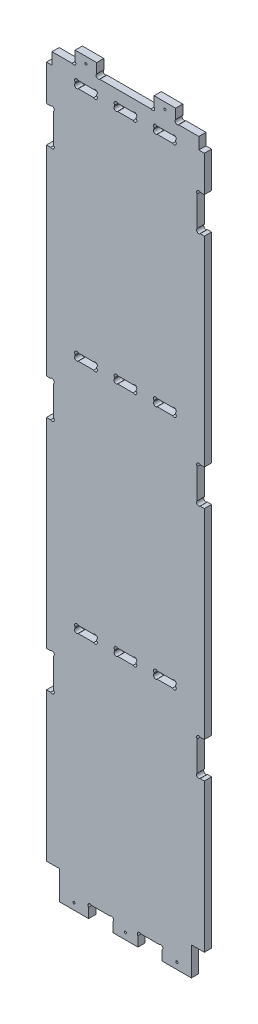
from build123d import *

# Parameters (mm, degrees)
BOSS_EXTRUDE1_DEPTH   = 10
SKETCH3_W             = 18
SKETCH3_H             = 40.02
CUT_EXTRUDE2_DEPTH    = 51
CAVITY2_START         = -19
CAVITY2_OUTLINE_W     = 80
CAVITY2_OUTLINE_H     = 10
CAVITY2_OUTLINE_R     = 1.5
CAVITY2_OUTLINE_W_2   = 32.3
CAVITY2_DEPTH         = 18
CAVITY2_START_2       = -1039.94
CAVITY2_2_OUTLINE_W   = 33.8
CAVITY2_2_OUTLINE_H   = 10
CAVITY2_2_OUTLINE_R   = 1.5
CAVITY2_2_DEPTH       = 18
CAVITY2_START_3       = -793.12
CAVITY2_3_OUTLINE_W   = 10
CAVITY2_3_OUTLINE_H   = 10
CAVITY2_3_DEPTH       = 50
CAVITY2_START_4       = -464.3
CAVITY2_4_OUTLINE_W   = 10
CAVITY2_4_OUTLINE_H   = 10
CAVITY2_4_DEPTH       = 50
CAVITY2_START_5       = -135.46
CAVITY2_5_OUTLINE_W   = 10
CAVITY2_5_OUTLINE_H   = 10
CAVITY2_5_DEPTH       = 50
CAVITY2_START_6       = -703.12
CAVITY2_6_DEPTH       = 10
CAVITY2_START_7       = -374.3
CAVITY2_7_DEPTH       = 10
CAVITY2_START_8       = -45.46
CAVITY2_8_DEPTH       = 10
F_3_0MM_DOWEL_HOLE1_D = 3
SKETCH7_R             = 3
CUT_EXTRUDE4_DEPTH    = 10
SKETCH6_W             = 80
SKETCH6_H             = 18
SKETCH6_W_2           = 32.3
CUT_EXTRUDE5_DEPTH    = 10
SKETCH8_W             = 30
SKETCH8_H             = 10
CUT_EXTRUDE6_DEPTH    = 1061.388704015


# Read off the part's stored shape, not the designer's step: Cavity2
with BuildPart() as part:
    # Sketch1 → Boss-Extrude1 (new body)
    with BuildSketch(Plane.XY):
        Polygon((13, -35.36), (5.3, -35.36), (5.3, -1), (-199.3, -1), (-199.3, -35.36), (-207, -35.36), (-207, -1039.94), (13, -1039.94), align=None)
    extrude(amount=-BOSS_EXTRUDE1_DEPTH)

    # Sketch3 → Cut-Extrude2 (cut)
    with BuildSketch(Plane.XY):
        with Locations((-198, -1019.93)):
            Rectangle(SKETCH3_W, SKETCH3_H)
        with Locations((4, -1019.93)):
            Rectangle(SKETCH3_W, SKETCH3_H)
    extrude(amount=-CUT_EXTRUDE2_DEPTH, mode=Mode.SUBTRACT)

    # Cavity2 outline → Cavity2 (cut)
    # profile 1 of 3: a face of its own
    with BuildSketch(Plane(origin=(0, 0, 0), x_dir=(1, 0, 0), z_dir=(0, 1, 0)).offset(CAVITY2_START)):
        with Locations((-97, 5)):
            Rectangle(CAVITY2_OUTLINE_W, CAVITY2_OUTLINE_H)
        with Locations((-97, 5)):
            Circle(CAVITY2_OUTLINE_R, mode=Mode.SUBTRACT)
    # profile 2 of 3: a face of its own
    with BuildSketch(Plane(origin=(0, 0, 0), x_dir=(1, 0, 0), z_dir=(0, 1, 0)).offset(CAVITY2_START)):
        with Locations((-183.15, 5)):
            Rectangle(CAVITY2_OUTLINE_W_2, CAVITY2_OUTLINE_H)
        with Locations((-183.15, 5)):
            Circle(CAVITY2_OUTLINE_R, mode=Mode.SUBTRACT)
    # profile 3 of 3: a face of its own
    with BuildSketch(Plane(origin=(0, 0, 0), x_dir=(1, 0, 0), z_dir=(0, 1, 0)).offset(CAVITY2_START)):
        with Locations((-10.85, 5)):
            Rectangle(CAVITY2_OUTLINE_W_2, CAVITY2_OUTLINE_H)
        with Locations((-10.85, 5)):
            Circle(CAVITY2_OUTLINE_R, mode=Mode.SUBTRACT)
    extrude(amount=CAVITY2_DEPTH, mode=Mode.SUBTRACT)

    # Cavity2 2 outline → Cavity2 2 (cut)
    # profile 1 of 2: a face of its own
    with BuildSketch(Plane(origin=(0, 0, 0), x_dir=(1, 0, 0), z_dir=(0, 1, 0)).offset(CAVITY2_START_2)):
        with Locations((-131.4, 5)):
            Rectangle(CAVITY2_2_OUTLINE_W, CAVITY2_2_OUTLINE_H)
        with Locations((-131.4, 5)):
            Circle(CAVITY2_2_OUTLINE_R, mode=Mode.SUBTRACT)
    # profile 2 of 2: a face of its own
    with BuildSketch(Plane(origin=(0, 0, 0), x_dir=(1, 0, 0), z_dir=(0, 1, 0)).offset(CAVITY2_START_2)):
        with Locations((-62.6, 5)):
            Rectangle(CAVITY2_2_OUTLINE_W, CAVITY2_2_OUTLINE_H)
        with Locations((-62.6, 5)):
            Circle(CAVITY2_2_OUTLINE_R, mode=Mode.SUBTRACT)
    extrude(amount=CAVITY2_2_DEPTH, mode=Mode.SUBTRACT)

    # Cavity2 3 outline → Cavity2 3 (cut)
    with BuildSketch(Plane(origin=(0, 0, 0), x_dir=(1, 0, 0), z_dir=(0, 1, 0)).offset(CAVITY2_START_3)):
        with Locations((-202, 5)):
            Rectangle(CAVITY2_3_OUTLINE_W, CAVITY2_3_OUTLINE_H)
        with Locations((8, 5)):
            Rectangle(CAVITY2_3_OUTLINE_W, CAVITY2_3_OUTLINE_H)
    extrude(amount=CAVITY2_3_DEPTH, mode=Mode.SUBTRACT)

    # Cavity2 4 outline → Cavity2 4 (cut)
    with BuildSketch(Plane(origin=(0, 0, 0), x_dir=(1, 0, 0), z_dir=(0, 1, 0)).offset(CAVITY2_START_4)):
        with Locations((-202, 5)):
            Rectangle(CAVITY2_4_OUTLINE_W, CAVITY2_4_OUTLINE_H)
        with Locations((8, 5)):
            Rectangle(CAVITY2_4_OUTLINE_W, CAVITY2_4_OUTLINE_H)
    extrude(amount=CAVITY2_4_DEPTH, mode=Mode.SUBTRACT)

    # Cavity2 5 outline → Cavity2 5 (cut)
    with BuildSketch(Plane(origin=(0, 0, 0), x_dir=(1, 0, 0), z_dir=(0, 1, 0)).offset(CAVITY2_START_5)):
        with Locations((-202, 5)):
            Rectangle(CAVITY2_5_OUTLINE_W, CAVITY2_5_OUTLINE_H)
        with Locations((8, 5)):
            Rectangle(CAVITY2_5_OUTLINE_W, CAVITY2_5_OUTLINE_H)
    extrude(amount=CAVITY2_5_DEPTH, mode=Mode.SUBTRACT)

    # Cavity2 6 outline → Cavity2 6 (cut)
    with BuildSketch(Plane(origin=(0, 0, 0), x_dir=(1, 0, 0), z_dir=(0, 1, 0)).offset(CAVITY2_START_6)):
        with BuildLine():
            Line((-137, 0), (-137, 5.757359313))
            ThreePointArc((-137, 5.757359313), (-137.878679656, 7.878679657), (-137, 10))
            Line((-137, 10), (-167, 10))
            ThreePointArc((-167, 10), (-166.121320344, 7.878679657), (-167, 5.757359313))
            Line((-167, 5.757359313), (-167, 0))
            Line((-167, 0), (-137, 0))
        make_face()
        with BuildLine():
            Line((-112, 5.757359313), (-112, 0))
            Line((-112, 0), (-82, 0))
            Line((-82, 0), (-82, 5.757359313))
            ThreePointArc((-82, 5.757359313), (-82.878679656, 7.878679657), (-82, 10))
            Line((-82, 10), (-112, 10))
            ThreePointArc((-112, 10), (-111.121320344, 7.878679657), (-112, 5.757359313))
        make_face()
        with BuildLine():
            Line((-57, 5.757359313), (-57, 0))
            Line((-57, 0), (-27, 0))
            Line((-27, 0), (-27, 5.757359313))
            ThreePointArc((-27, 5.757359313), (-27.878679656, 7.878679657), (-27, 10))
            Line((-27, 10), (-57, 10))
            ThreePointArc((-57, 10), (-56.121320344, 7.878679657), (-57, 5.757359313))
        make_face()
    extrude(amount=CAVITY2_6_DEPTH, mode=Mode.SUBTRACT)

    # Cavity2 7 outline → Cavity2 7 (cut)
    with BuildSketch(Plane(origin=(0, 0, 0), x_dir=(1, 0, 0), z_dir=(0, 1, 0)).offset(CAVITY2_START_7)):
        with BuildLine():
            Line((-137, 0), (-137, 5.757359313))
            ThreePointArc((-137, 5.757359313), (-137.878679656, 7.878679657), (-137, 10))
            Line((-137, 10), (-167, 10))
            ThreePointArc((-167, 10), (-166.121320344, 7.878679657), (-167, 5.757359313))
            Line((-167, 5.757359313), (-167, 0))
            Line((-167, 0), (-137, 0))
        make_face()
        with BuildLine():
            Line((-112, 5.757359313), (-112, 0))
            Line((-112, 0), (-82, 0))
            Line((-82, 0), (-82, 5.757359313))
            ThreePointArc((-82, 5.757359313), (-82.878679656, 7.878679657), (-82, 10))
            Line((-82, 10), (-112, 10))
            ThreePointArc((-112, 10), (-111.121320344, 7.878679657), (-112, 5.757359313))
        make_face()
        with BuildLine():
            Line((-57, 5.757359313), (-57, 0))
            Line((-57, 0), (-27, 0))
            Line((-27, 0), (-27, 5.757359313))
            ThreePointArc((-27, 5.757359313), (-27.878679656, 7.878679657), (-27, 10))
            Line((-27, 10), (-57, 10))
            ThreePointArc((-57, 10), (-56.121320344, 7.878679657), (-57, 5.757359313))
        make_face()
    extrude(amount=CAVITY2_7_DEPTH, mode=Mode.SUBTRACT)

    # Cavity2 8 outline → Cavity2 8 (cut)
    with BuildSketch(Plane(origin=(0, 0, 0), x_dir=(1, 0, 0), z_dir=(0, 1, 0)).offset(CAVITY2_START_8)):
        with BuildLine():
            Line((-137, 0), (-137, 5.757359313))
            ThreePointArc((-137, 5.757359313), (-137.878679656, 7.878679657), (-137, 10))
            Line((-137, 10), (-167, 10))
            ThreePointArc((-167, 10), (-166.121320344, 7.878679657), (-167, 5.757359313))
            Line((-167, 5.757359313), (-167, 0))
            Line((-167, 0), (-137, 0))
        make_face()
        with BuildLine():
            Line((-112, 5.757359313), (-112, 0))
            Line((-112, 0), (-82, 0))
            Line((-82, 0), (-82, 5.757359313))
            ThreePointArc((-82, 5.757359313), (-82.878679656, 7.878679657), (-82, 10))
            Line((-82, 10), (-112, 10))
            ThreePointArc((-112, 10), (-111.121320344, 7.878679657), (-112, 5.757359313))
        make_face()
        with BuildLine():
            Line((-57, 5.757359313), (-57, 0))
            Line((-57, 0), (-27, 0))
            Line((-27, 0), (-27, 5.757359313))
            ThreePointArc((-27, 5.757359313), (-27.878679656, 7.878679657), (-27, 10))
            Line((-27, 10), (-57, 10))
            ThreePointArc((-57, 10), (-56.121320344, 7.878679657), (-57, 5.757359313))
        make_face()
    extrude(amount=CAVITY2_8_DEPTH, mode=Mode.SUBTRACT)

    # Ø3.0mm Dowel Hole1 (through all)
    with Locations(Plane.XY):
        with Locations((-25.35, -1030.94), (-152, -10), (-42, -10), (-168.65, -1030.94), (-97, -1030.94)):
            Hole(F_3_0MM_DOWEL_HOLE1_D / 2)

    # Sketch7 → Cut-Extrude4 (cut)
    with BuildSketch(Plane.XY):
        with Locations((-134.878679656, -16.878679657)):
            Circle(SKETCH7_R)
        with Locations((-59.121320344, -16.878679657)):
            Circle(SKETCH7_R)
        with Locations((5.121320344, -133.338679656)):
            Circle(SKETCH7_R)
        with Locations((5.121320344, -87.581320344)):
            Circle(SKETCH7_R)
        with Locations((5.121320344, -416.421320344)):
            Circle(SKETCH7_R)
        with Locations((5.121320344, -462.178679657)):
            Circle(SKETCH7_R)
        with Locations((5.121320344, -790.998679657)):
            Circle(SKETCH7_R)
        with Locations((5.121320344, -745.241320344)):
            Circle(SKETCH7_R)
        with Locations((-199.121320344, -790.998679657)):
            Circle(SKETCH7_R)
        with Locations((-199.121320344, -745.241320344)):
            Circle(SKETCH7_R)
        with Locations((-199.121320344, -462.178679657)):
            Circle(SKETCH7_R)
        with Locations((-199.121320344, -416.421320344)):
            Circle(SKETCH7_R)
        with Locations((-199.121320344, -87.581320344)):
            Circle(SKETCH7_R)
        with Locations((-199.121320344, -133.338679656)):
            Circle(SKETCH7_R)
        with Locations((-146.178679656, -1024.061320344)):
            Circle(SKETCH7_R)
        with Locations((-116.621320344, -1024.061320344)):
            Circle(SKETCH7_R)
        with Locations((-77.378679656, -1024.061320344)):
            Circle(SKETCH7_R)
        with Locations((-47.821320344, -1024.061320344)):
            Circle(SKETCH7_R)
        with Locations((-169.121320344, -16.878679657)):
            Circle(SKETCH7_R)
        with Locations((-24.878679656, -16.878679657)):
            Circle(SKETCH7_R)
        with BuildLine():
            ThreePointArc((-164.034165929, -40.46), (-164.878679656, -34.581320344), (-165.723193384, -40.46))
            ThreePointArc((-165.723193384, -40.46), (-164.878679656, -46.338679656), (-164.034165929, -40.46))
        make_face()
        with BuildLine():
            ThreePointArc((-55.723193384, -40.46), (-54.878679656, -46.338679656), (-54.034165929, -40.46))
            ThreePointArc((-54.034165929, -40.46), (-54.878679656, -34.581320344), (-55.723193384, -40.46))
        make_face()
        with BuildLine():
            ThreePointArc((-138.276806616, -40.46), (-139.121320344, -34.581320344), (-139.965834071, -40.46))
            ThreePointArc((-139.965834071, -40.46), (-139.121320344, -46.338679656), (-138.276806616, -40.46))
        make_face()
        with BuildLine():
            ThreePointArc((-29.965834071, -40.46), (-29.121320344, -46.338679656), (-28.276806616, -40.46))
            ThreePointArc((-28.276806616, -40.46), (-29.121320344, -34.581320344), (-29.965834071, -40.46))
        make_face()
        with BuildLine():
            ThreePointArc((-110.723193384, -40.46), (-109.878679656, -46.338679656), (-109.034165929, -40.46))
            ThreePointArc((-109.034165929, -40.46), (-109.878679656, -34.581320344), (-110.723193384, -40.46))
        make_face()
        with BuildLine():
            ThreePointArc((-84.965834071, -40.46), (-84.121320344, -46.338679656), (-83.276806616, -40.46))
            ThreePointArc((-83.276806616, -40.46), (-84.121320344, -34.581320344), (-84.965834071, -40.46))
        make_face()
        with BuildLine():
            ThreePointArc((-164.034165929, -369.3), (-164.878679656, -363.421320344), (-165.723193384, -369.3))
            ThreePointArc((-165.723193384, -369.3), (-164.878679656, -375.178679657), (-164.034165929, -369.3))
        make_face()
        with BuildLine():
            ThreePointArc((-138.276806616, -369.3), (-139.121320344, -363.421320344), (-139.965834071, -369.3))
            ThreePointArc((-139.965834071, -369.3), (-139.121320344, -375.178679657), (-138.276806616, -369.3))
        make_face()
        with BuildLine():
            ThreePointArc((-109.034165929, -369.3), (-109.878679656, -363.421320344), (-110.723193384, -369.3))
            ThreePointArc((-110.723193384, -369.3), (-109.878679656, -375.178679657), (-109.034165929, -369.3))
        make_face()
        with BuildLine():
            ThreePointArc((-83.276806616, -369.3), (-84.121320344, -363.421320344), (-84.965834071, -369.3))
            ThreePointArc((-84.965834071, -369.3), (-84.121320344, -375.178679657), (-83.276806616, -369.3))
        make_face()
        with BuildLine():
            ThreePointArc((-54.034165929, -369.3), (-54.878679656, -363.421320344), (-55.723193384, -369.3))
            ThreePointArc((-55.723193384, -369.3), (-54.878679656, -375.178679657), (-54.034165929, -369.3))
        make_face()
        with BuildLine():
            ThreePointArc((-28.276806616, -369.3), (-29.121320344, -363.421320344), (-29.965834071, -369.3))
            ThreePointArc((-29.965834071, -369.3), (-29.121320344, -375.178679657), (-28.276806616, -369.3))
        make_face()
        with BuildLine():
            ThreePointArc((-164.034165929, -698.12), (-164.878679656, -692.241320344), (-165.723193384, -698.12))
            ThreePointArc((-165.723193384, -698.12), (-164.878679656, -703.998679657), (-164.034165929, -698.12))
        make_face()
        with BuildLine():
            ThreePointArc((-139.965834071, -698.12), (-139.121320344, -703.998679657), (-138.276806616, -698.12))
            ThreePointArc((-138.276806616, -698.12), (-139.121320344, -692.241320344), (-139.965834071, -698.12))
        make_face()
        with BuildLine():
            ThreePointArc((-109.034165929, -698.12), (-109.878679656, -692.241320344), (-110.723193384, -698.12))
            ThreePointArc((-110.723193384, -698.12), (-109.878679656, -703.998679657), (-109.034165929, -698.12))
        make_face()
        with BuildLine():
            ThreePointArc((-84.965834071, -698.12), (-84.121320344, -703.998679657), (-83.276806616, -698.12))
            ThreePointArc((-83.276806616, -698.12), (-84.121320344, -692.241320344), (-84.965834071, -698.12))
        make_face()
        with BuildLine():
            ThreePointArc((-54.034165929, -698.12), (-54.878679656, -692.241320344), (-55.723193384, -698.12))
            ThreePointArc((-55.723193384, -698.12), (-54.878679656, -703.998679657), (-54.034165929, -698.12))
        make_face()
        with BuildLine():
            ThreePointArc((-29.965834071, -698.12), (-29.121320344, -703.998679657), (-28.276806616, -698.12))
            ThreePointArc((-28.276806616, -698.12), (-29.121320344, -692.241320344), (-29.965834071, -698.12))
        make_face()
    extrude(amount=-CUT_EXTRUDE4_DEPTH, mode=Mode.SUBTRACT)

    # Sketch6 → Cut-Extrude5 (cut)
    with BuildSketch(Plane.XY):
        with Locations((-97, -10)):
            Rectangle(SKETCH6_W, SKETCH6_H)
        Polygon((-148.3, -1039.94), (-114.5, -1039.94), (-114.5, -1026.182640687), (-118.742640687, -1026.182640687), (-118.742640687, -1021.94), (-144.057359313, -1021.94), (-144.057359313, -1026.182640687), (-148.3, -1026.182640687), align=None)
        Polygon((-79.5, -1039.94), (-45.7, -1039.94), (-45.7, -1026.182640687), (-49.942640687, -1026.182640687), (-49.942640687, -1021.94), (-75.257359313, -1021.94), (-75.241477029, -1026.182640687), (-79.5, -1026.182640687), align=None)
        with Locations((-10.85, -10)):
            Rectangle(SKETCH6_W_2, SKETCH6_H)
        with Locations((-183.15, -10)):
            Rectangle(SKETCH6_W_2, SKETCH6_H)
    extrude(amount=-CUT_EXTRUDE5_DEPTH, mode=Mode.SUBTRACT)

    # Sketch8 → Cut-Extrude6 (cut, through all)
    with BuildSketch(Plane.XY):
        with Locations((-152, -40.46)):
            Rectangle(SKETCH8_W, SKETCH8_H)
        with Locations((-97, -40.46)):
            Rectangle(SKETCH8_W, SKETCH8_H)
        with Locations((-42, -40.46)):
            Rectangle(SKETCH8_W, SKETCH8_H)
        with Locations((-152, -369.3)):
            Rectangle(SKETCH8_W, SKETCH8_H)
        with Locations((-97, -369.3)):
            Rectangle(SKETCH8_W, SKETCH8_H)
        with Locations((-42, -369.3)):
            Rectangle(SKETCH8_W, SKETCH8_H)
        with Locations((-152, -698.12)):
            Rectangle(SKETCH8_W, SKETCH8_H)
        with Locations((-97, -698.12)):
            Rectangle(SKETCH8_W, SKETCH8_H)
        with Locations((-42, -698.12)):
            Rectangle(SKETCH8_W, SKETCH8_H)
    extrude(amount=-CUT_EXTRUDE6_DEPTH, mode=Mode.SUBTRACT)


solid = part.part
